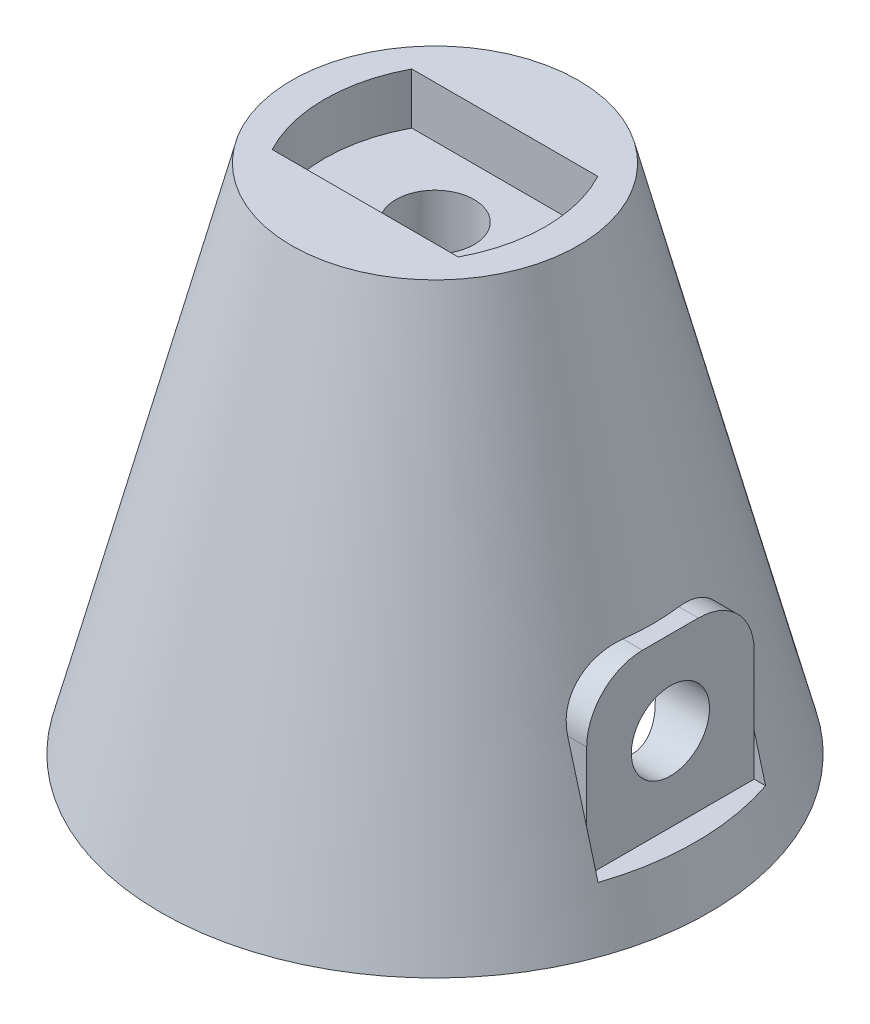
from build123d import *

# Parameters (mm, degrees)
CUT_EXTRUDE1_DEPTH      = 18
CUT_EXTRUDE1_DEPTH_BACK = 18
SKETCH2_R               = 2.1
SKETCH3_W               = 9
SKETCH3_H               = 9
CUT_EXTRUDE4_DEPTH      = 3.1
SKETCH4_W               = 9
SKETCH4_H               = 9
SKETCH4_R               = 2.1
BOSS_EXTRUDE2_DEPTH     = 1
BOSS_EXTRUDE3_START     = -1.850787983
BOSS_EXTRUDE3_DEPTH     = 0.850787983
FILLET2_R               = 3
CUT_EXTRUDE5_DEPTH      = 3
SKETCH9_W               = 10
SKETCH9_H               = 7.5
SKETCH9_R               = 2.1
CUT_EXTRUDE6_DEPTH      = 2.75
SKETCH10_R              = 2.1
CUT_EXTRUDE7_DEPTH      = 37.75
SKETCH11_R              = 3.5
CUT_EXTRUDE8_DEPTH      = 17
SKETCH12_R              = 3.5
CUT_EXTRUDE9_DEPTH      = 4


# Read off the part's stored shape, not the designer's step: Boss-Extrude3
with BuildPart() as part:
    # Sketch1 → Revolve2 (revolve)
    with BuildSketch(Plane.XY, mode=Mode.PRIVATE) as revolve2_sk:
        with BuildLine():
            Line((0, 27.5), (0, 16))
            ThreePointArc((0, 16), (4.539948066, 14.894753), (7.995845625, 11.75))
            Line((7.995845625, 11.75), (9.755894266, 7.4))
            Line((9.755894266, 7.4), (12.75, 0))
            Line((12.75, 0), (14.75, 0))
            Line((14.75, 0), (7.7, 27.5))
            Line((7.7, 27.5), (0, 27.5))
        make_face()
    revolve(revolve2_sk.sketch.rotate(Axis((0, 27.5, 0), (0, -1, 0)), 90), axis=Axis((0, 27.5, 0), (0, -1, 0)))

    # Sketch2 → Cut-Extrude1 (cut, two sides: drawn at the far end of the back side and taken through both)
    with BuildSketch(Plane(origin=(0, 0, 0), x_dir=(0, 0, -1), z_dir=(1, 0, 0)).offset(-CUT_EXTRUDE1_DEPTH_BACK)):
        with Locations(Location((0, 7.4, 0), (0, 0, 322.555636433))):
            Circle(SKETCH2_R)
    extrude(amount=CUT_EXTRUDE1_DEPTH + CUT_EXTRUDE1_DEPTH_BACK, mode=Mode.SUBTRACT)

    # Sketch3 → Cut-Extrude4 (cut)
    with BuildSketch(Plane(origin=(14.75, 0, 0), x_dir=(0, 0, -1), z_dir=(1, 0, 0))):
        with Locations((0, 7.4)):
            Rectangle(SKETCH3_W, SKETCH3_H)
    extrude(amount=-CUT_EXTRUDE4_DEPTH, mode=Mode.SUBTRACT)

    # Sketch4 → Boss-Extrude2 (add)
    with BuildSketch(Plane(origin=(11.65, 0, 0), x_dir=(0, 0, -1), z_dir=(1, 0, 0))):
        with Locations((0, 7.4)):
            Rectangle(SKETCH4_W, SKETCH4_H)
        with Locations(Location((0, 7.4, 0), (0, 0, 328.733960859))):
            Circle(SKETCH4_R, mode=Mode.SUBTRACT)
    extrude(amount=BOSS_EXTRUDE2_DEPTH)

    # Boss-Extrude3 outline → Boss-Extrude3 (add)
    with BuildSketch(Plane(origin=(12.65, 0, 0), x_dir=(0, 0, -1), z_dir=(1, 0, 0)).offset(BOSS_EXTRUDE3_START)):
        with BuildLine():
            Line((1.769303732, 8.531178281), (4.5, 8.531178281))
            Line((4.5, 8.531178281), (4.5, 11.9))
            Line((4.5, 11.9), (-4.5, 11.9))
            Line((-4.5, 11.9), (-4.5, 8.531178281))
            Line((-4.5, 8.531178281), (-1.769303732, 8.531178281))
            ThreePointArc((-1.769303732, 8.531178281), (0, 9.5), (1.769303732, 8.531178281))
        make_face()
    extrude(amount=BOSS_EXTRUDE3_DEPTH)

    # Fillet2
    fillet2_edges = [part.edges().sort_by_distance(p)[0] for p in [
        (11.724606008, 11.9, -4.5),
        (11.724606008, 11.9, 4.5),
    ]]
    fillet(fillet2_edges, radius=FILLET2_R)

    # Sketch8 → Cut-Extrude5 (cut)
    with BuildSketch(Plane(origin=(-14.75, 0, 0), x_dir=(0, 0, -1), z_dir=(1, 0, 0))):
        Polygon((3.6, 5.3), (3.6, 9.5), (0, 11.5), (-3.6, 9.5), (-3.6, 5.3), (0, 3.3), align=None)
    extrude(amount=CUT_EXTRUDE5_DEPTH, mode=Mode.SUBTRACT)

    # Sketch9 → Cut-Extrude6 (cut)
    # profile 1 of 3: a face of its own
    with BuildSketch(Plane(origin=(0, 27.5, 0), x_dir=(1, 0, 0), z_dir=(0, 1, 0))):
        with BuildLine():
            Line((-5, -3.75), (-5, 3.75))
            ThreePointArc((-5, 3.75), (-5.933352987, 0), (-5, -3.75))
        make_face()
    # profile 2 of 3: a face of its own
    with BuildSketch(Plane(origin=(0, 27.5, 0), x_dir=(1, 0, 0), z_dir=(0, 1, 0))):
        Rectangle(SKETCH9_W, SKETCH9_H)
        with Locations(Location((0, 0, 0), (0, 0, 270))):
            Circle(SKETCH9_R, mode=Mode.SUBTRACT)
    # profile 3 of 3: a face of its own
    with BuildSketch(Plane(origin=(0, 27.5, 0), x_dir=(1, 0, 0), z_dir=(0, 1, 0))):
        with BuildLine():
            ThreePointArc((5, 3.75), (5.933352987, 0), (5, -3.75))
            Line((5, -3.75), (5, 3.75))
        make_face()
    extrude(amount=-CUT_EXTRUDE6_DEPTH, mode=Mode.SUBTRACT)

    # Sketch10 → Cut-Extrude7 (cut)
    with BuildSketch(Plane(origin=(0, 27.5, 0), x_dir=(1, 0, 0), z_dir=(0, 1, 0))):
        with Locations(Location((0, 0, 0), (0, 0, 270))):
            Circle(SKETCH10_R)
    extrude(amount=-CUT_EXTRUDE7_DEPTH, mode=Mode.SUBTRACT)

    # Sketch11 → Cut-Extrude8 (cut)
    with BuildSketch(Plane(origin=(0, 0, 0), x_dir=(-1, 0, 0), z_dir=(0, -1, 0))):
        with Locations(Location((0, 0, 0), (0, 0, 90))):
            Circle(SKETCH11_R)
    extrude(amount=-CUT_EXTRUDE8_DEPTH, mode=Mode.SUBTRACT)

    # Sketch12 → Cut-Extrude9 (cut)
    with BuildSketch(Plane(origin=(0, 17, 0), x_dir=(-1, 0, 0), z_dir=(0, -1, 0))):
        with Locations(Location((0, 0, 0), (0, 0, 90))):
            Circle(SKETCH12_R)
    extrude(amount=-CUT_EXTRUDE9_DEPTH, mode=Mode.SUBTRACT)


solid = part.part
